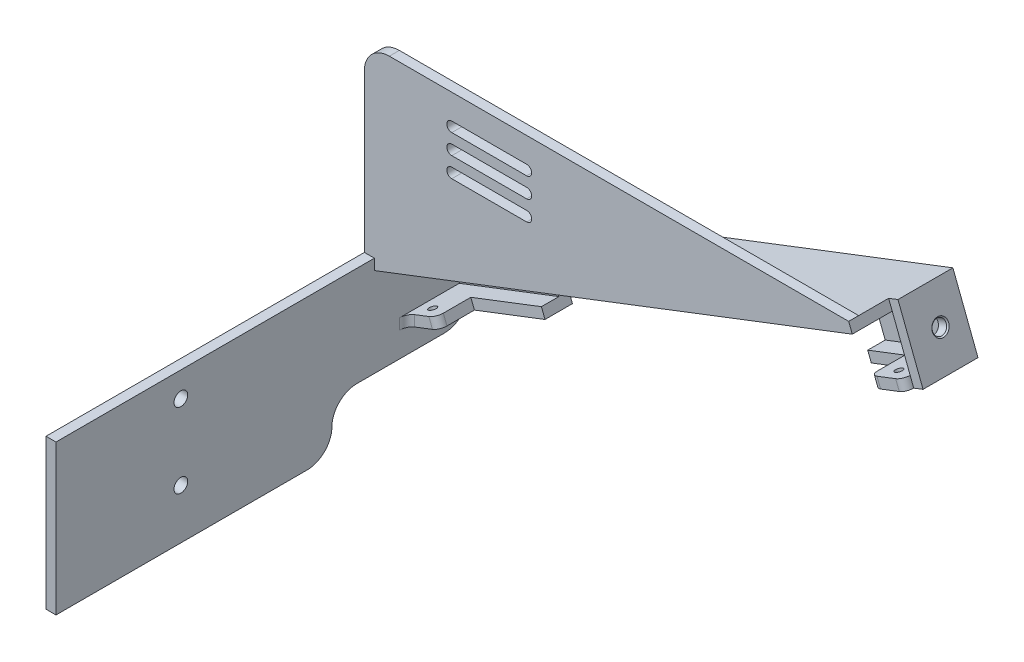
from build123d import *

# Parameters (mm, degrees)
SKETCH_1_W          = 165.5
SKETCH_1_H          = 60
EXTRUDE_1_DEPTH     = 4
EXTRUDE_2_DEPTH     = 4
SKETCH_3_W          = 214.285714285
SKETCH_3_H          = 25
EXTRUDE_5_DEPTH     = 4
SKETCH_4_R          = 2.75
CUT_EXTRUDE_1_DEPTH = 4
SKETCH_5_W          = 55
SKETCH_5_H          = 20
CUT_EXTRUDE_2_DEPTH = 4
FILLET_1_R          = 10
SKETCH_6_W          = 186.285714285
SKETCH_6_H          = 14
CUT_EXTRUDE_3_DEPTH = 4
SKETCH_7_R          = 1.5
CUT_EXTRUDE_4_DEPTH = 4
FILLET_2_R          = 3
CUT_EXTRUDE_5_DEPTH = 293.240221501
CUT_EXTRUDE_6_DEPTH = 10
SKETCH_11_W         = 207.248718004
SKETCH_11_H         = 34
EXTRUDE_6_DEPTH     = 4
EXTRUDE_7_DEPTH     = 4
FILLET_3_R          = 10
CUT_EXTRUDE_7_DEPTH = 4
SKETCH_15_W         = 22
SKETCH_15_H         = 28
EXTRUDE_8_DEPTH     = 4
SKETCH_16_R         = 2.75
CUT_EXTRUDE_8_DEPTH = 10
CHAMFER_1_SIZE      = 0.5


with BuildPart() as part:
    # 草图1 → 凸台-拉伸1 (new body)
    with BuildSketch(Plane(origin=(0, 0, 0), x_dir=(0, 0, -1), z_dir=(1, 0, 0))):
        with Locations((82.75, 30)):
            Rectangle(SKETCH_1_W, SKETCH_1_H)
    extrude(amount=EXTRUDE_1_DEPTH)

    # 草图2 → 凸台-拉伸2 (add)
    with BuildSketch(Plane(origin=(0, 0, -165.5), x_dir=(-1, 0, 0), z_dir=(0, 0, -1))):
        Polygon((-4, 30), (-204, 106.930925816), (-193.94769236, 133.06425915), (-4, 60), align=None)
    extrude(amount=-EXTRUDE_2_DEPTH)

    # 草图3 → 凸台-拉伸5 (add)
    with BuildSketch(Plane(origin=(-9.536752084, 24.793025648, 0), x_dir=(0.9333333333333335, 0.3590109871422999, 0), z_dir=(0.3590109871422999, -0.9333333333333335, 0))):
        with Locations((121.646520091, -153)):
            Rectangle(SKETCH_3_W, SKETCH_3_H)
    extrude(amount=-EXTRUDE_5_DEPTH)

    # 草图4 → 切除-拉伸1 (cut)
    with BuildSketch(Plane(origin=(4, 0, 0), x_dir=(0, 0, -1), z_dir=(1, 0, 0))):
        with Locations((50, 50)):
            Circle(SKETCH_4_R)
        with Locations((50, 20)):
            Circle(SKETCH_4_R)
    extrude(amount=-CUT_EXTRUDE_1_DEPTH, mode=Mode.SUBTRACT)

    # 草图5 → 切除-拉伸2 (cut)
    with BuildSketch(Plane(origin=(4, 0, 0), x_dir=(0, 0, -1), z_dir=(1, 0, 0))):
        with Locations((138, 10)):
            Rectangle(SKETCH_5_W, SKETCH_5_H)
    extrude(amount=-CUT_EXTRUDE_2_DEPTH, mode=Mode.SUBTRACT)

    # 圆角1
    fillet_1_edges = [part.edges().sort_by_distance(p)[0] for p in [
        (2, 20, -165.5),
        (2, 20, -110.5),
        (2, 0, -110.5),
    ]]
    fillet(fillet_1_edges, radius=FILLET_1_R - 0.0001)  # a hair under: the kernel refuses the full size

    # 草图6 → 切除-拉伸3 (cut)
    with BuildSketch(Plane(origin=(-9.536752084, 24.793025648, 0), x_dir=(0.9333333333333335, 0.35901098714229984, 0), z_dir=(0.35901098714229984, -0.9333333333333335, 0))):
        with Locations((121.646520091, -147.5)):
            Rectangle(SKETCH_6_W, SKETCH_6_H)
    extrude(amount=-CUT_EXTRUDE_3_DEPTH, mode=Mode.SUBTRACT)

    # 草图7 → 切除-拉伸4 (cut)
    with BuildSketch(Plane(origin=(-9.536752084, 24.793025648, 0), x_dir=(0.9333333333333335, 0.35901098714229984, 0), z_dir=(0.35901098714229984, -0.9333333333333335, 0))):
        with Locations((221.789377233, -145.5)):
            Circle(SKETCH_7_R)
        with Locations((21.789377233, -145.5)):
            Circle(SKETCH_7_R)
    extrude(amount=-CUT_EXTRUDE_4_DEPTH, mode=Mode.SUBTRACT)

    # 圆角2
    fillet_2_edges = [part.edges().sort_by_distance(p)[0] for p in [
        (4, 32.142857143, -140.5),
        (203.281978026, 108.797592483, -140.5),
        (16.348644692, 36.892820487, -140.5),
        (190.215311359, 103.771438663, -140.5),
    ]]
    fillet(fillet_2_edges, radius=FILLET_2_R)

    # 草图8 → 切除-拉伸5 (cut, through all)
    with BuildSketch(Plane.XY.offset(-161.5)):
        Polygon((45.333333333, 45.899058002), (39.948168526, 59.899058002), (170.614835193, 110.160596202), (176, 96.160596202), align=None)
    extrude(amount=-CUT_EXTRUDE_5_DEPTH, mode=Mode.SUBTRACT)

    # 草图9 → 切除-拉伸6 (cut)
    with BuildSketch(Plane(origin=(0, 0, -161.5), x_dir=(-1, 0, 0), z_dir=(0, 0, -1))):
        Polygon((-43.897289385, 49.632391335), (-174.563956051, 99.893929535), (-176, 96.160596202), (-45.333333333, 45.899058002), align=None)
    extrude(amount=-CUT_EXTRUDE_6_DEPTH, mode=Mode.SUBTRACT)

    # 草图11 → 凸台-拉伸6 (add)
    with BuildSketch(Plane(origin=(-19.589059724, 50.926358981, 0), x_dir=(0.9333333333333335, 0.3590109871422999, 0), z_dir=(-0.3590109871422999, 0.9333333333333335, 0))):
        with Locations((125.165018231, 148.5)):
            Rectangle(SKETCH_11_W, SKETCH_11_H)
    extrude(amount=-EXTRUDE_6_DEPTH)

    # 草图12 → 凸台-拉伸7 (add)
    with BuildSketch(Plane.XY.offset(-131.5)):
        Polygon((4, 55.714285714), (4, 60), (0, 60), (0, 133.06425915), (193.94769236, 133.06425915), (195.383736309, 129.330925816), align=None)
    extrude(amount=EXTRUDE_7_DEPTH)

    # 圆角3
    fillet_3_edges = [part.edges().sort_by_distance(p)[0] for p in [
        (0, 133.06425915, -129.5),
    ]]
    fillet(fillet_3_edges, radius=FILLET_3_R)

    # 草图14 → 切除-拉伸7 (cut)
    with BuildSketch(Plane(origin=(0, 0, -131.5), x_dir=(-1, 0, 0), z_dir=(0, 0, -1))):
        with BuildLine():
            Line((-65, 123.06425915), (-35, 123.06425915))
            ThreePointArc((-35, 123.06425915), (-33, 121.06425915), (-35, 119.06425915))
            Line((-35, 119.06425915), (-65, 119.06425915))
            ThreePointArc((-65, 119.06425915), (-67, 121.06425915), (-65, 123.06425915))
        make_face()
        with BuildLine():
            Line((-65, 115.06425915), (-35, 115.06425915))
            ThreePointArc((-35, 115.06425915), (-33, 113.06425915), (-35, 111.06425915))
            Line((-35, 111.06425915), (-65, 111.06425915))
            ThreePointArc((-65, 111.06425915), (-67, 113.06425915), (-65, 115.06425915))
        make_face()
        with BuildLine():
            Line((-65, 107.06425915), (-35, 107.06425915))
            ThreePointArc((-35, 107.06425915), (-33, 105.06425915), (-35, 103.06425915))
            Line((-35, 103.06425915), (-65, 103.06425915))
            ThreePointArc((-65, 103.06425915), (-67, 105.06425915), (-65, 107.06425915))
        make_face()
    extrude(amount=-CUT_EXTRUDE_7_DEPTH, mode=Mode.SUBTRACT)

    # 草图15 → 凸台-拉伸8 (add)
    with BuildSketch(Plane(origin=(213.536752084, 82.137900168, 0), x_dir=(0, 0, -1), z_dir=(0.9333333333333338, 0.35901098714229945, 0))):
        with Locations((154.5, 40.563956051)):
            Rectangle(SKETCH_15_W, SKETCH_15_H)
    extrude(amount=EXTRUDE_8_DEPTH)

    # 草图16 → 切除-拉伸8 (cut)
    with BuildSketch(Plane(origin=(217.270085418, 83.573944117, 0), x_dir=(0, 0, -1), z_dir=(0.9333333333333335, 0.35901098714229984, 0))):
        with Locations(Location((155.5, 40.563956051, 0), (0, 0, 90))):
            Circle(SKETCH_16_R)
    extrude(amount=-CUT_EXTRUDE_8_DEPTH, mode=Mode.SUBTRACT)

    # 倒角1
    chamfer_1_edges = [part.edges().sort_by_distance(p)[0] for p in [
        (203.694459728, 118.866969765, -155.5),
    ]]
    chamfer(chamfer_1_edges, length=CHAMFER_1_SIZE)


solid = part.part
